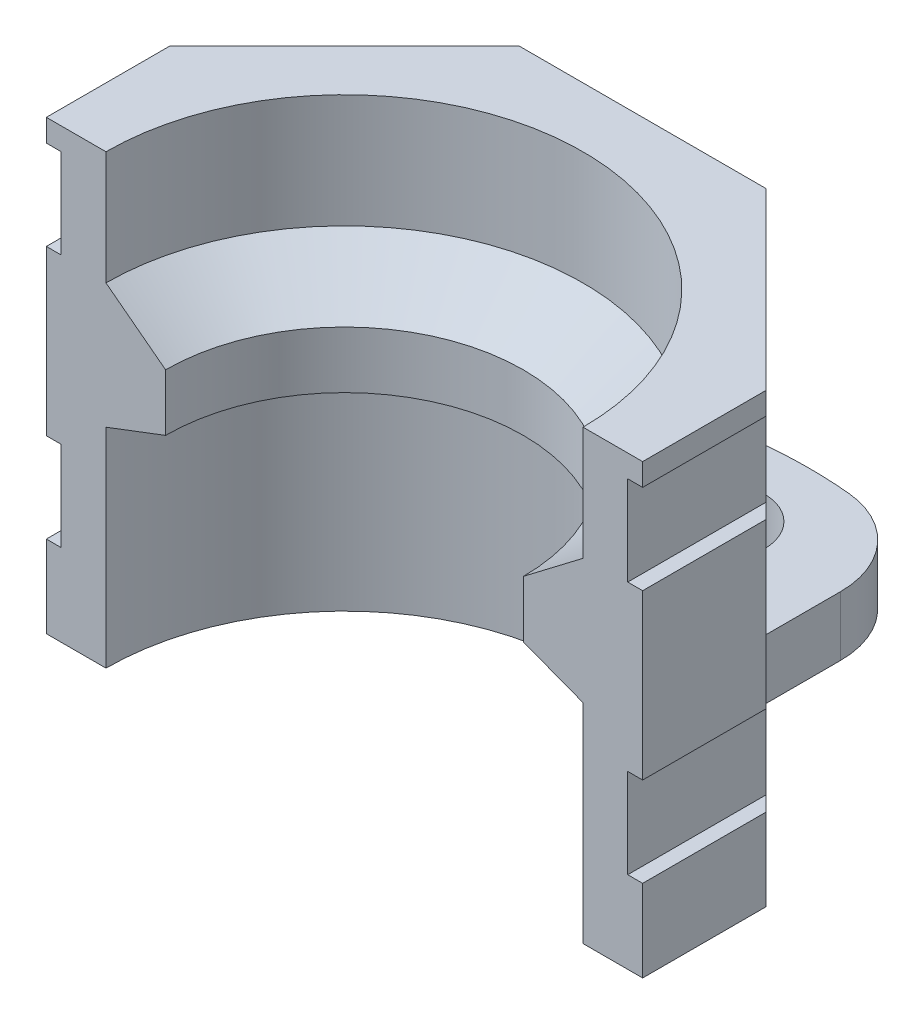
from build123d import *

# Parameters (mm, degrees)
BOSS_EXTRUDE1_DEPTH     = 20
CHAMFER2_SIZE           = 3
CUT_EXTRUDE5_DEPTH      = 25.494897428
CUT_EXTRUDE5_DEPTH_BACK = 25.494897428
SKETCH7_W               = 0.5
SKETCH7_H               = 3
SKETCH8_R               = 1.6
BOSS_EXTRUDE2_DEPTH     = 2
CUT_EXTRUDE6_DEPTH      = 29.795839016
CUT_EXTRUDE7_DEPTH      = 29.795839016


with BuildPart() as part:
    # Sketch2 → Boss-Extrude1 (new body)
    with BuildSketch(Plane(origin=(0, 0, 0), x_dir=(1, 0, 0), z_dir=(0, 1, 0))):
        Polygon((4.142135624, 10), (-4.142135624, 10), (-10, 4.142135624), (-10, -4.142135624), (-4.142135624, -10), (4.142135624, -10), (10, -4.142135624), (10, 4.142135624), align=None)
    extrude(amount=BOSS_EXTRUDE1_DEPTH)

    # Sketch4 → Cut-Revolve3 (revolve, cut)
    with BuildSketch(Plane.XY):
        Polygon((0, 0), (0, 20), (-4.625, 20), (-4.375, 17), (-1, 17), (-1, 15), (-8, 15), (-8, 11.19), (-6, 9.666), (-6, 7.761), (-8, 6.999), (-8, 0), align=None)
    revolve(axis=Axis((0, -24.161732467, 0), (0, 1, 0)), mode=Mode.SUBTRACT)

    # Chamfer2
    chamfer2_edges = [part.edges().sort_by_distance(p)[0] for p in [
        (7.071067812, 20, 7.071067812),
        (0, 20, 10),
        (-7.071067812, 20, 7.071067812),
        (-10, 20, 0),
        (-7.071067812, 20, -7.071067812),
        (0, 20, -10),
        (7.071067812, 20, -7.071067812),
        (10, 20, 0),
    ]]
    chamfer(chamfer2_edges, length=CHAMFER2_SIZE)

    # Sketch7 → Cut-Extrude5 (cut, two sides: drawn at the far end of the back side and taken through both)
    with BuildSketch(Plane.XY.offset(-CUT_EXTRUDE5_DEPTH_BACK)):
        with Locations((-9.75, 4.25)):
            Rectangle(SKETCH7_W, SKETCH7_H)
        with Locations((-9.75, 12.75)):
            Rectangle(SKETCH7_W, SKETCH7_H)
        with Locations((9.75, 4.25)):
            Rectangle(SKETCH7_W, SKETCH7_H)
        with Locations((9.75, 12.75)):
            Rectangle(SKETCH7_W, SKETCH7_H)
    extrude(amount=CUT_EXTRUDE5_DEPTH + CUT_EXTRUDE5_DEPTH_BACK, mode=Mode.SUBTRACT)

    # Sketch8 → Boss-Extrude2 (add)
    # profile 1 of 3: a face of its own
    with BuildSketch(Plane(origin=(0, 0, 0), x_dir=(1, 0, 0), z_dir=(0, 1, 0))):
        with BuildLine():
            Line((-4.142135624, 12.548124123), (-4.142135624, 10))
            Line((-4.142135624, 10), (4.095866003, 10))
            Line((4.095866003, 10), (4.095866003, 12.548124123))
            ThreePointArc((4.095866003, 12.548124123), (3.311245365, 14.571016676), (1.367803148, 15.535773733))
            ThreePointArc((1.367803148, 15.535773733), (0.673050873, 15.583402879), (-0.02313481, 15.599978591))
            ThreePointArc((-0.02313481, 15.599978591), (-0.719320494, 15.583402879), (-1.414072769, 15.535773733))
            ThreePointArc((-1.414072769, 15.535773733), (-3.357514986, 14.571016676), (-4.142135624, 12.548124123))
        make_face()
        with Locations((-0.02313481, 12.499978591)):
            Circle(SKETCH8_R, mode=Mode.SUBTRACT)
    # profile 2 of 3: a face of its own
    with BuildSketch(Plane(origin=(0, 0, 0), x_dir=(1, 0, 0), z_dir=(0, 1, 0))):
        with BuildLine():
            Line((-10.128539545, -10), (-4.142135624, -10))
            Line((-4.142135624, -10), (-10, -4.142135624))
            Line((-10, -4.142135624), (-10, -0.556499887))
            ThreePointArc((-10, -0.556499887), (-10.331678206, -1.92765225), (-11.253372536, -2.995617043))
            Line((-11.253372536, -2.995617043), (-12.378979155, -3.801652714))
            ThreePointArc((-12.378979155, -3.801652714), (-13.582941475, -5.698533832), (-13.132054617, -7.899530034))
            Line((-13.132054617, -7.899530034), (-12.628242471, -8.658760164))
            ThreePointArc((-12.628242471, -8.658760164), (-11.546939966, -9.643509078), (-10.128539545, -10))
        make_face()
        with Locations((-10.813731602, -6.270024629)):
            Circle(SKETCH8_R, mode=Mode.SUBTRACT)
    # profile 3 of 3: a face of its own
    with BuildSketch(Plane(origin=(0, 0, 0), x_dir=(1, 0, 0), z_dir=(0, 1, 0))):
        with BuildLine():
            Line((9.953730379, -0.556499887), (9.953730379, -4.142135624))
            Line((9.953730379, -4.142135624), (4.095866003, -10))
            Line((4.095866003, -10), (10.082269924, -10))
            ThreePointArc((10.082269924, -10), (11.500670345, -9.643509078), (12.58197285, -8.658760164))
            Line((12.58197285, -8.658760164), (13.085784996, -7.899530034))
            ThreePointArc((13.085784996, -7.899530034), (13.536671855, -5.698533832), (12.332709534, -3.801652714))
            Line((12.332709534, -3.801652714), (11.207102915, -2.995617043))
            ThreePointArc((11.207102915, -2.995617043), (10.285408585, -1.92765225), (9.953730379, -0.556499887))
        make_face()
        with Locations((10.836866412, -6.229953962)):
            Circle(SKETCH8_R, mode=Mode.SUBTRACT)
    extrude(amount=BOSS_EXTRUDE2_DEPTH)

    # Sketch9 → Cut-Extrude6 (cut, through all)
    with BuildSketch(Plane.XY):
        Polygon((-7, 20), (-10, 17), (-10, 15), (10, 15), (10, 17), (7, 20), align=None)
    extrude(amount=-CUT_EXTRUDE6_DEPTH, mode=Mode.SUBTRACT)

    # Sketch10 → Cut-Extrude7 (cut, through all)
    with BuildSketch(Plane.XZ):
        with BuildLine():
            Line((0, 0), (-10, 0))
            Line((-10, 0), (-10, 0.556499887))
            ThreePointArc((-10, 0.556499887), (-10.331678206, 1.92765225), (-11.253372536, 2.995617043))
            Line((-11.253372536, 2.995617043), (-12.378979155, 3.801652714))
            ThreePointArc((-12.378979155, 3.801652714), (-13.582941475, 5.698533832), (-13.132054617, 7.899530034))
            Line((-13.132054617, 7.899530034), (-12.628242471, 8.658760164))
            ThreePointArc((-12.628242471, 8.658760164), (-11.546939966, 9.643509078), (-10.128539545, 10))
            Line((-10.128539545, 10), (10.082269924, 10))
            ThreePointArc((10.082269924, 10), (11.500670345, 9.643509078), (12.58197285, 8.658760164))
            Line((12.58197285, 8.658760164), (13.085784996, 7.899530034))
            ThreePointArc((13.085784996, 7.899530034), (13.536671855, 5.698533832), (12.332709534, 3.801652714))
            Line((12.332709534, 3.801652714), (11.207102915, 2.995617043))
            ThreePointArc((11.207102915, 2.995617043), (10.416125771, 2.156675768), (10, 1.081358769))
            Line((10, 1.081358769), (10, 0))
            Line((10, 0), (0, 0))
        make_face()
    extrude(amount=-CUT_EXTRUDE7_DEPTH, mode=Mode.SUBTRACT)


solid = part.part
